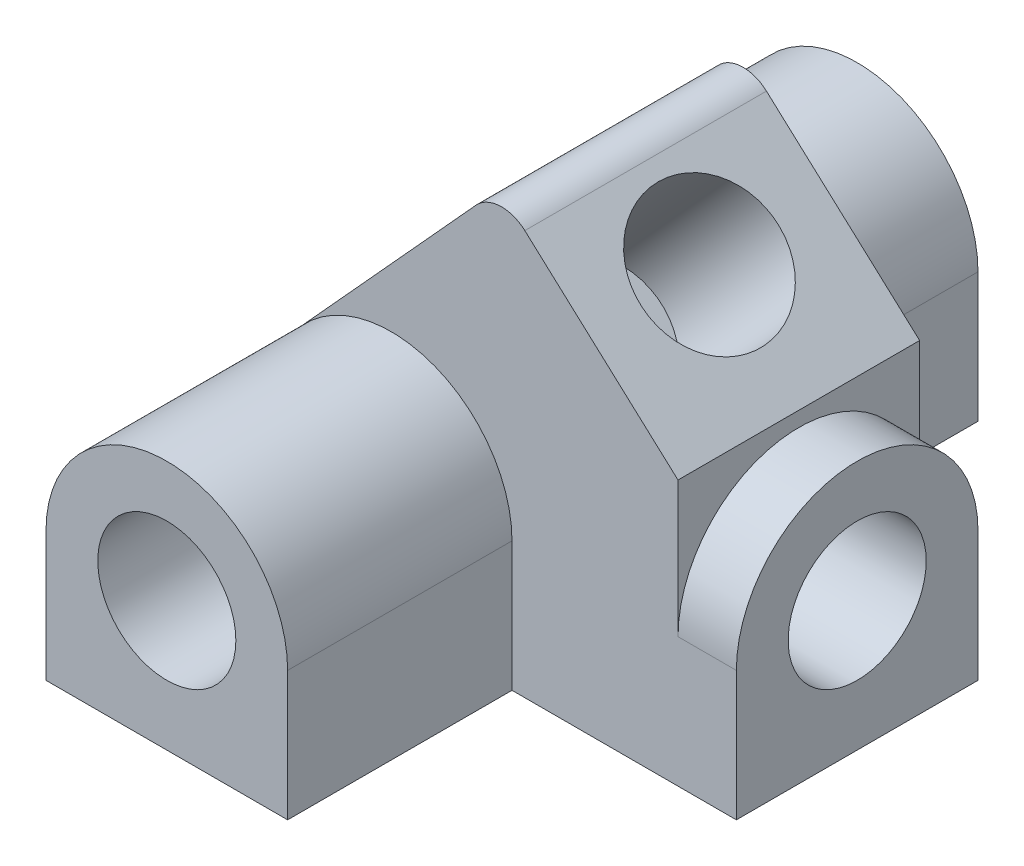
from build123d import *

# Parameters (mm, degrees)
DODANIE_WYCI_GNI_CIE1_DEPTH             = 20
DODANIE_WYCI_GNI_CIE1_DEPTH_BACK        = 20
SZKIC1_R                                = 7
SZKIC1_R_2                              = 4
DODANIE_WYCI_GNI_CIE2_DEPTH             = 10
DODANIE_WYCI_GNI_CIE2_DEPTH_BACK        = 10
SZKIC2_R                                = 4
DODANIE_WYCI_GNI_CIE4_REACH             = 28.181
DODANIE_WYCI_GNI_CIE4_END_RADIUS        = 7
SZKIC3_W                                = 14
SZKIC3_H                                = 14
DODANIE_WYCI_GNI_CIE4_DIRECTION_2_DEPTH = 10
SZKIC9_R                                = 7
DODANIE_WYCI_GNI_CIE6_DEPTH             = 20
DODANIE_WYCI_GNI_CIE5_REACH             = 39.607
SZKIC12_R                               = 4
WYTNIJ_WYCI_GNI_CIE3_DEPTH              = 40.984557912
DODANIE_WYCI_GNI_CIE7_START             = 8
DODANIE_WYCI_GNI_CIE7_DEPTH             = 8.618630395
SZKIC4_R                                = 4
WYTNIJ_WYCI_GNI_CIE1_DEPTH              = 10
SZKIC10_R                               = 4
WYTNIJ_WYCI_GNI_CIE2_DEPTH              = 10
ZAOKR_GLENIE1_R                         = 2
WYTNIJ_WYCI_GNI_CIE4_DEPTH              = 1


with BuildPart() as part:
    # Szkic1 → Dodanie-wyciągnięcie1 (new, two sides: drawn at the far end of the back side and taken through both)
    with BuildSketch(Plane.XY.offset(-DODANIE_WYCI_GNI_CIE1_DEPTH_BACK)):
        Circle(SZKIC1_R)
        Circle(SZKIC1_R_2, mode=Mode.SUBTRACT)
    extrude(amount=DODANIE_WYCI_GNI_CIE1_DEPTH + DODANIE_WYCI_GNI_CIE1_DEPTH_BACK)

    # Szkic2 → Dodanie-wyciągnięcie2 (add, two sides: drawn at the far end of the back side and taken through both)
    with BuildSketch(Plane.XY.offset(-DODANIE_WYCI_GNI_CIE2_DEPTH_BACK)):
        Circle(SZKIC2_R)
    extrude(amount=DODANIE_WYCI_GNI_CIE2_DEPTH + DODANIE_WYCI_GNI_CIE2_DEPTH_BACK)

    # Dodanie-wyciągnięcie4: up to this cylinder (the profile starts outside it)
    dodanie_wyci_gni_cie4_end = Plane(origin=(0, 0, 0), z_dir=(0, 0, 1)) * Cylinder(DODANIE_WYCI_GNI_CIE4_END_RADIUS, 71.362, mode=Mode.PRIVATE)
    # Szkic3 → Dodanie-wyciągnięcie4 (add, up to the surface)
    with BuildSketch(Plane(origin=(4.711087595, 5.177417665, 0), x_dir=(0, 0, 1), z_dir=(0.6730125135097745, 0.7396310949786087, 0)), mode=Mode.PRIVATE) as dodanie_wyci_gni_cie4_sk1:
        Rectangle(SZKIC3_W, SZKIC3_H)
    dodanie_wyci_gni_cie4_tool1 = extrude(dodanie_wyci_gni_cie4_sk1.sketch, amount=-DODANIE_WYCI_GNI_CIE4_REACH, mode=Mode.PRIVATE) - dodanie_wyci_gni_cie4_end
    add(dodanie_wyci_gni_cie4_tool1.solids().sort_by_distance((4.711088, 5.177418, 0))[0])
    add(dodanie_wyci_gni_cie4_tool1.solids().sort_by_distance((4.711088, 5.177418, 0))[1])

    # Szkic3 → Dodanie-wyciągnięcie4 direction 2 (add)
    with BuildSketch(Plane(origin=(4.711087595, 5.177417665, 0), x_dir=(0, 0, 1), z_dir=(0.6730125135097745, 0.7396310949786087, 0))):
        Rectangle(SZKIC3_W, SZKIC3_H)
    extrude(amount=DODANIE_WYCI_GNI_CIE4_DIRECTION_2_DEPTH)

    # Szkic9 → Dodanie-wyciągnięcie6 (add)
    with BuildSketch(Plane(origin=(0, 0, 0), x_dir=(0, 0, -1), z_dir=(1, 0, 0))):
        Circle(SZKIC9_R)
    extrude(amount=DODANIE_WYCI_GNI_CIE6_DEPTH)

    # Szkic8 → Dodanie-wyciągnięcie5 (add, up to next)
    with BuildSketch(Plane(origin=(0, -7.5, 0), x_dir=(1, 0, 0), z_dir=(0, 1, 0)), mode=Mode.PRIVATE) as dodanie_wyci_gni_cie5_sk1:
        Polygon((7, 20), (-7, 20), (-7, -20), (7, -20), (7, -7), (20, -7), (20, 7), (7, 7), align=None)
    dodanie_wyci_gni_cie5_tool1 = extrude(dodanie_wyci_gni_cie5_sk1.sketch, amount=DODANIE_WYCI_GNI_CIE5_REACH, mode=Mode.PRIVATE) - part.part
    add(dodanie_wyci_gni_cie5_tool1.solids().sort_by_distance((3.311321, -7.5, 0))[0])

    # Szkic12 → Wytnij-wyciągnięcie3 (cut, through all)
    with BuildSketch(Plane.XY.offset(10)):
        Circle(SZKIC12_R)
    extrude(amount=-WYTNIJ_WYCI_GNI_CIE3_DEPTH, mode=Mode.SUBTRACT)

    # Dodanie-wyciągnięcie7: read off the stored shape, not the designer's step
    # Dodanie-wyciągnięcie7 outline → Dodanie-wyciągnięcie7 (add)
    with BuildSketch(Plane.YZ.offset(DODANIE_WYCI_GNI_CIE7_START)):
        with BuildLine():
            Line((7.86264102, 7), (0, 7))
            ThreePointArc((0, 7), (7, 0), (0, -7))
            Line((0, -7), (7.86264102, -7))
            Line((7.86264102, -7), (7.86264102, 7))
        make_face()
    extrude(amount=DODANIE_WYCI_GNI_CIE7_DEPTH)

    # Szkic4 → Wytnij-wyciągnięcie1 (cut)
    with BuildSketch(Plane(origin=(11.44121273, 12.573728615, 0), x_dir=(0, 0, -1), z_dir=(0.6730125135097745, 0.7396310949786088, 0))):
        with Locations(Location((0, 0, 0), (0, 0, 90))):
            Circle(SZKIC4_R)
    extrude(amount=-WYTNIJ_WYCI_GNI_CIE1_DEPTH, mode=Mode.SUBTRACT)

    # Szkic10 → Wytnij-wyciągnięcie2 (cut)
    with BuildSketch(Plane(origin=(20, 0, 0), x_dir=(0, 0, -1), z_dir=(1, 0, 0))):
        Circle(SZKIC10_R)
    extrude(amount=-WYTNIJ_WYCI_GNI_CIE2_DEPTH, mode=Mode.SUBTRACT)

    # Zaokrąglenie1
    zaokr_glenie1_edges = [part.edges().sort_by_distance(p)[0] for p in [
        (6.263795065, 17.284816209, 0),
    ]]
    fillet(zaokr_glenie1_edges, radius=ZAOKR_GLENIE1_R)

    # Szkic14 → Wytnij-wyciągnięcie4 (cut, along a direction that is not the sketch's normal)
    with BuildSketch(Plane(origin=(-5.177417665, 4.711087595, 0), x_dir=(0, 0, 1), z_dir=(-0.7396310949786086, 0.6730125135097746, 0))):
        with BuildLine():
            Line((-2.686538462, 3), (-2.686538462, 12.525))
            Line((-2.686538462, 12.525), (-1.160096154, 12.525))
            add(Edge.make_bspline(
                [(-1.160096154, 12.525), (-1.053235648, 12.525012195), (-0.846462595, 12.525035793), (-0.548143042, 12.51455979), (-0.271476851, 12.501007906), (-0.01734448, 12.4858465), (0.214686622, 12.459720367), (0.424263612, 12.432186277), (0.611805228, 12.398981861), (0.727752018, 12.369196471), (0.782301683, 12.355183293)],
                knots=[0, 0, 0, 0, 1.311965854, 2.538629056, 3.664479157, 4.713267157, 5.663616078, 6.530575999, 7.308677837, 8, 8, 8, 8], degree=3))
            add(Edge.make_bspline(
                [(0.782301683, 12.355183293), (0.85393093, 12.335417456), (0.994490509, 12.296630538), (1.195816681, 12.218298682), (1.386802639, 12.131227269), (1.567215194, 12.031895073), (1.735946541, 11.919102874), (1.892355443, 11.79195552), (2.039815254, 11.655556701), (2.173090012, 11.50610502), (2.293548434, 11.348181634), (2.398205206, 11.181827924), (2.489138527, 11.009587547), (2.561909002, 10.829292972), (2.616740188, 10.641774504), (2.656843488, 10.447832876), (2.682835858, 10.24685441), (2.685291796, 10.11012219), (2.686538462, 10.040715144)],
                knots=[0, 0, 0, 0, 1.099996261, 2.158545794, 3.195537121, 4.207578794, 5.205712374, 6.197378256, 7.190519799, 8.17788031, 9.159561366, 10.129234751, 11.085776129, 12.040971148, 13.00380137, 13.975669004, 14.972423361, 16, 16, 16, 16], degree=3))
            add(Edge.make_bspline(
                [(2.686538462, 10.040715144), (2.6832788, 9.951545308), (2.676862558, 9.776025442), (2.635875166, 9.518218515), (2.559017418, 9.274553912), (2.458450925, 9.040540989), (2.321711936, 8.817052614), (2.148079865, 8.604195051), (1.940366984, 8.395414096), (1.781039737, 8.270263996), (1.698167067, 8.205168269)],
                knots=[0, 0, 0, 0, 0.986156485, 1.941127874, 2.875419072, 3.804401753, 4.751181392, 5.761612777, 6.835722519, 8, 8, 8, 8], degree=3))
            add(Edge.make_bspline(
                [(1.698167067, 8.205168269), (1.765323103, 8.170885695), (1.89699751, 8.103667053), (2.083936483, 7.99317967), (2.257021567, 7.875662326), (2.417028822, 7.753479516), (2.560601912, 7.621451735), (2.693669212, 7.487186605), (2.809665872, 7.342991291), (2.913393581, 7.194005189), (3.00355202, 7.038070964), (3.082070078, 6.875451953), (3.148391466, 6.705592614), (3.204554132, 6.529357394), (3.246440263, 6.346140126), (3.273750912, 6.155875284), (3.294661651, 5.959211768), (3.29628831, 5.825249491), (3.297115385, 5.757136418)],
                knots=[0, 0, 0, 0, 1.164658916, 2.283573913, 3.35186032, 4.395461096, 5.390182219, 6.362969632, 7.312859996, 8.245001507, 9.165155236, 10.092416118, 11.032087915, 11.979892451, 12.947605196, 13.931445124, 14.948243989, 16, 16, 16, 16], degree=3))
            add(Edge.make_bspline(
                [(3.297115385, 5.757136418), (3.291748226, 5.627044343), (3.281156159, 5.370308155), (3.203712138, 4.993360467), (3.069448812, 4.63597987), (2.889160851, 4.299586747), (2.667011396, 3.993919126), (2.411603228, 3.726156945), (2.125507722, 3.499502202), (1.861550038, 3.346527834), (1.633247428, 3.243867728), (1.444148642, 3.180396777), (1.241060554, 3.121597384), (1.020263078, 3.080307236), (0.785758971, 3.042513952), (0.535261803, 3.019179595), (0.26923975, 3.003366477), (0.086524304, 3.001144846), (-0.007632212, 3)],
                knots=[0, 0, 0, 0, 1.284142165, 2.534249414, 3.780121997, 5.041676246, 6.291546858, 7.49970053, 8.684500223, 9.883330709, 10.50184324, 11.153274765, 11.851151195, 12.587658647, 13.369265475, 14.195992086, 15.070362669, 16, 16, 16, 16], degree=3))
            Line((-0.007632212, 3), (-2.686538462, 3))
        make_face()
        with BuildLine():
            Line((-0.976923077, 10.815384615), (-0.976923077, 8.739423077))
            Line((-0.976923077, 8.739423077), (-0.52280649, 8.739423077))
            add(Edge.make_bspline(
                [(-0.52280649, 8.739423077), (-0.461087966, 8.739961286), (-0.341944091, 8.741000265), (-0.1698534, 8.754381963), (-0.009836849, 8.77721197), (0.137498653, 8.809065573), (0.273525591, 8.849515004), (0.397374985, 8.898184382), (0.508502292, 8.957566312), (0.63760652, 9.046018318), (0.774079, 9.176179404), (0.894214189, 9.364224061), (0.964973013, 9.580474702), (0.972853637, 9.732991398), (0.976923077, 9.811748798)],
                knots=[0, 0, 0, 0, 1.065314748, 2.056525647, 2.977365736, 3.853934255, 4.656397591, 5.425096493, 6.14721249, 6.826394842, 8.123232004, 9.372140726, 10.643011755, 12, 12, 12, 12], degree=3))
            add(Edge.make_bspline(
                [(0.976923077, 9.811748798), (0.97366678, 9.885518189), (0.967370861, 10.028148341), (0.896125823, 10.228413777), (0.785468194, 10.40588994), (0.654821309, 10.527357859), (0.531791881, 10.610316867), (0.426446534, 10.664941841), (0.310822106, 10.71384156), (0.18268023, 10.751231476), (0.042752669, 10.779287553), (-0.108280873, 10.799891382), (-0.27068098, 10.813915224), (-0.382851079, 10.814884312), (-0.440760216, 10.815384615)],
                knots=[0, 0, 0, 0, 1.347982417, 2.606269829, 3.849316587, 5.153353503, 5.842674298, 6.568177932, 7.326619318, 8.142485038, 9.012069166, 9.942760135, 10.937925643, 12, 12, 12, 12], degree=3))
            Line((-0.440760216, 10.815384615), (-0.976923077, 10.815384615))
        make_face(mode=Mode.SUBTRACT)
        with BuildLine():
            Line((-0.976923077, 7.151923077), (-0.976923077, 4.709615385))
            Line((-0.976923077, 4.709615385), (-0.484645433, 4.709615385))
            add(Edge.make_bspline(
                [(-0.484645433, 4.709615385), (-0.387321516, 4.710171393), (-0.200204141, 4.711240387), (0.067841168, 4.724156384), (0.311561364, 4.747435193), (0.530310682, 4.776496911), (0.724424178, 4.815870993), (0.893245702, 4.865930091), (1.039090422, 4.921003819), (1.161083845, 4.989026413), (1.260745483, 5.068187842), (1.350679663, 5.149092725), (1.424006389, 5.242424151), (1.482023863, 5.344175661), (1.532237884, 5.451819674), (1.562523436, 5.569559649), (1.585581792, 5.693906057), (1.586850755, 5.779913778), (1.5875, 5.823918269)],
                knots=[0, 0, 0, 0, 1.753078804, 3.370512758, 4.83203934, 6.162291463, 7.344201807, 8.395507345, 9.331626367, 10.147333109, 10.898971645, 11.62040215, 12.321813352, 13.025280112, 13.727906689, 14.453419512, 15.208716525, 16, 16, 16, 16], degree=3))
            add(Edge.make_bspline(
                [(1.5875, 5.823918269), (1.586068229, 5.874238098), (1.583279523, 5.972247587), (1.560504132, 6.115498915), (1.519113807, 6.249233534), (1.466980673, 6.37687122), (1.394434648, 6.493842097), (1.308216175, 6.604194086), (1.204042251, 6.704190327), (1.086892595, 6.799878966), (0.95024912, 6.883659553), (0.794047716, 6.956354053), (0.617439814, 7.017065822), (0.41987835, 7.065404572), (0.202229419, 7.106429001), (-0.037095577, 7.130925114), (-0.296103456, 7.14914395), (-0.475703734, 7.150975652), (-0.56859976, 7.151923077)],
                knots=[0, 0, 0, 0, 0.845221588, 1.646264278, 2.427170338, 3.19324141, 3.95557735, 4.731569926, 5.540061037, 6.376114724, 7.268642756, 8.224665384, 9.265483498, 10.400594375, 11.639216012, 12.983232105, 14.439614077, 16, 16, 16, 16], degree=3))
            Line((-0.56859976, 7.151923077), (-0.976923077, 7.151923077))
        make_face(mode=Mode.SUBTRACT)
    extrude(amount=-WYTNIJ_WYCI_GNI_CIE4_DEPTH, dir=(0, 1, 0), mode=Mode.SUBTRACT)


solid = part.part
